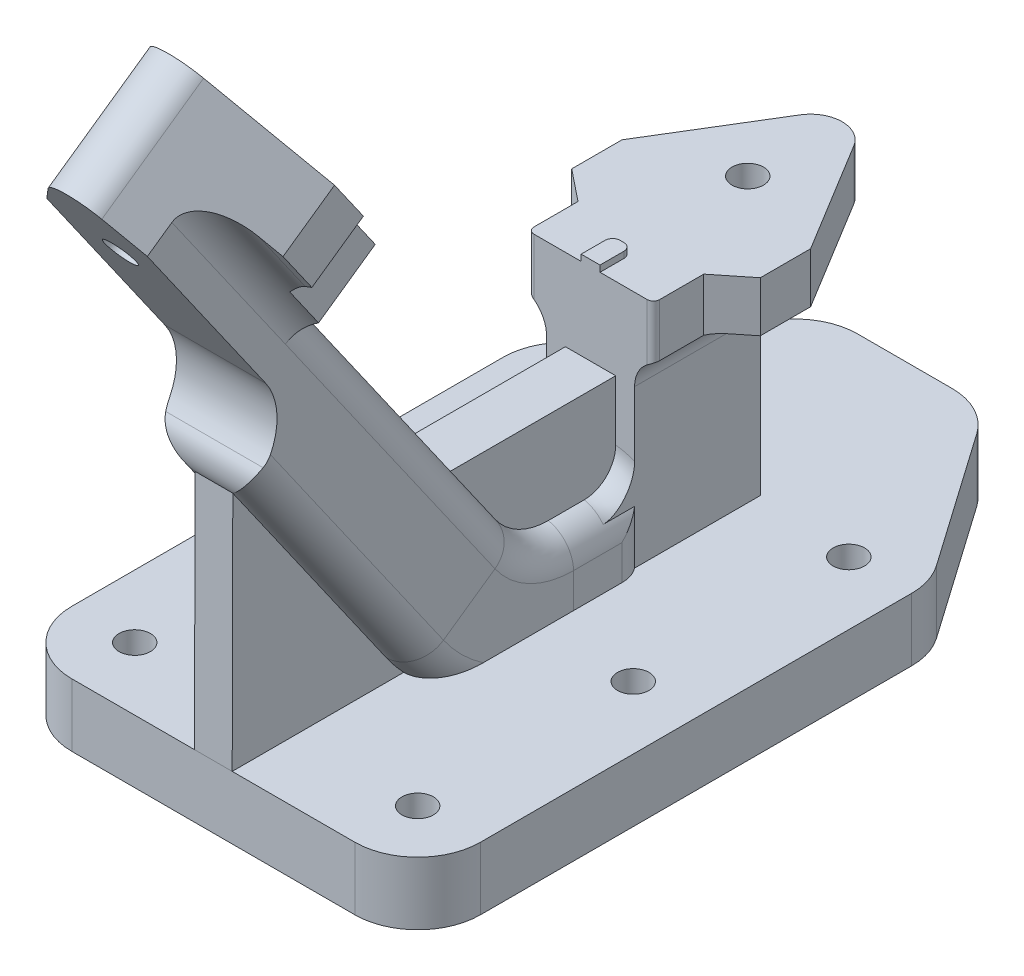
from build123d import *

# Parameters (mm, degrees)
BOSS_EXTRUDE1_DEPTH = 4
SKETCH2_R           = 2.5
CUT_EXTRUDE1_DEPTH  = 12
BOSS_EXTRUDE2_DEPTH = 40
SKETCH8_W           = 16
SKETCH8_H           = 20
BOSS_EXTRUDE4_DEPTH = 10
CUT_EXTRUDE2_START  = -60
CUT_EXTRUDE2_DEPTH  = 60
SKETCH11_R          = 2.5
CUT_EXTRUDE3_DEPTH  = 60
CUT_EXTRUDE4_DEPTH  = 30
FILLET1_R           = 5
SKETCH4_R           = 2.5
BOSS_EXTRUDE3_DEPTH = 10
RIB2_REACH          = 126.18
SKETCH14_WALL_W     = 288.63523274
SKETCH14_WALL_H     = 6
BOSS_EXTRUDE5_DEPTH = 1
BOSS_EXTRUDE6_DEPTH = 1
FILLET2_R           = 5
FILLET3_R           = 5
RIB3_REACH          = 126.18
SKETCH17_WALL_W     = 276.553771966
SKETCH17_WALL_H     = 8
FILLET4_R           = 5


with BuildPart() as part:
    # Sketch1 → Boss-Extrude1 (new, symmetric)
    with BuildSketch(Plane(origin=(0, 0, 0), x_dir=(1, 0, 0), z_dir=(0, 1, 0))):
        with BuildLine():
            Line((-15, -4), (-10, -8))
            Line((-10, -8), (-10, -15))
            ThreePointArc((-10, -15), (-9.707106781, -15.707106781), (-9, -16))
            Line((-9, -16), (9, -16))
            ThreePointArc((9, -16), (9.707106781, -15.707106781), (10, -15))
            Line((10, -15), (10, -8))
            Line((10, -8), (15, -4))
            Line((15, -4), (15, 4))
            Line((15, 4), (4.269254688, 21.602588021))
            ThreePointArc((4.269254688, 21.602588021), (0, 24), (-4.269254688, 21.602588021))
            Line((-4.269254688, 21.602588021), (-15, 4))
            Line((-15, 4), (-15, -4))
        make_face()
    extrude(amount=BOSS_EXTRUDE1_DEPTH, both=True)

    # Sketch2 → Cut-Extrude1 (cut, symmetric)
    with BuildSketch(Plane(origin=(0, 4, 0), x_dir=(1, 0, 0), z_dir=(0, 1, 0))):
        with Locations(Location((0, 9, 0), (0, 0, 270))):
            Circle(SKETCH2_R)
    extrude(amount=CUT_EXTRUDE1_DEPTH, both=True, mode=Mode.SUBTRACT)

    # Sketch3 → Boss-Extrude2 (add)
    with BuildSketch(Plane.XZ.offset(4)):
        with BuildLine():
            Line((-7, 16), (7, 16))
            Line((7, 16), (7, -4))
            Line((7, -4), (5.590169944, -4))
            ThreePointArc((5.590169944, -4), (0, -1.5), (-5.590169944, -4))
            Line((-5.590169944, -4), (-7, -4))
            Line((-7, -4), (-7, 16))
        make_face()
    extrude(amount=BOSS_EXTRUDE2_DEPTH)

    # Sweep2: sweep along a path in Sketch7
    with BuildLine(Plane(origin=(0, 0, 0), x_dir=(0, 0, -1), z_dir=(1, 0, 0))) as sweep2_path:
        Line((-104.705010427, 63.264235636), (-43.100894938, -24.715559106))
        ThreePointArc((-43.100894938, -24.715559106), (-35.952826317, -30.984247042), (-26.717854052, -33.244030379))
        Line((-26.717854052, -33.244030379), (-16, -33.244030379))
    # Sketch8 → Sweep2 (sweep)
    with BuildSketch(Plane(origin=(0, 63.264235636, 104.705010427), x_dir=(1, 0, 0), z_dir=(0, 0.8191520442889891, 0.5735764363510499))):
        with Locations((0, -0.242925444)):
            Rectangle(SKETCH8_W, SKETCH8_H)
    sweep(path=sweep2_path.line)

    # Sketch9 → Boss-Extrude4 (add)
    with BuildSketch(Plane(origin=(0, -22.785538427, 32.541121288), x_dir=(-1, 0, 0), z_dir=(-1.207999395513893e-15, 0.57357643635105, -0.819152044288989))):
        with BuildLine():
            Line((-15, 82.596209614), (-15, 74.596209614))
            Line((-15, 74.596209614), (-10, 70.596209614))
            Line((-10, 70.596209614), (-10, 62.596209614))
            Line((-10, 62.596209614), (10, 62.596209614))
            Line((10, 62.596209614), (10, 70.596209614))
            Line((10, 70.596209614), (15, 74.596209614))
            Line((15, 74.596209614), (15, 82.596209614))
            Line((15, 82.596209614), (4.269254688, 100.198797635))
            ThreePointArc((4.269254688, 100.198797635), (0, 102.596209614), (-4.269254688, 100.198797635))
            Line((-4.269254688, 100.198797635), (-15, 82.596209614))
        make_face()
    extrude(amount=BOSS_EXTRUDE4_DEPTH)

    # Sketch10 → Cut-Extrude2 (cut)
    with BuildSketch(Plane(origin=(0, -17.049774064, 24.349600845), x_dir=(-1, 0, 0), z_dir=(-1.207999395513893e-15, 0.57357643635105, -0.819152044288989)).offset(CUT_EXTRUDE2_START)):
        with BuildLine():
            Line((-13.101392133, 85.710663561), (-13.101392133, 131.179887232))
            Line((-13.101392133, 131.179887232), (12.430457948, 131.179887232))
            Line((12.430457948, 131.179887232), (12.430457948, 86.811256084))
            Line((12.430457948, 86.811256084), (4.269254688, 100.198797635))
            ThreePointArc((4.269254688, 100.198797635), (0, 102.596209614), (-4.269254688, 100.198797635))
            Line((-4.269254688, 100.198797635), (-13.101392133, 85.710663561))
        make_face()
    extrude(amount=CUT_EXTRUDE2_DEPTH, mode=Mode.SUBTRACT)

    # Sketch11 → Cut-Extrude3 (cut)
    with BuildSketch(Plane(origin=(0, -17.049774064, 24.349600845), x_dir=(-1, 0, 0), z_dir=(-1.207999395513893e-15, 0.57357643635105, -0.819152044288989))):
        with Locations(Location((0, 87.596209614, 0), (0, 0, 90))):
            Circle(SKETCH11_R)
    extrude(amount=-CUT_EXTRUDE3_DEPTH, mode=Mode.SUBTRACT)

    # Sketch12 → Cut-Extrude4 (cut, symmetric)
    with BuildSketch(Plane(origin=(0, 0, 0), x_dir=(0, 0, -1), z_dir=(1, 0, 0))):
        with BuildLine():
            Line((-117.126001141, 43.234336681), (-99.38041715, 55.659928361))
            Line((-99.38041715, 55.659928361), (-75.673754093, 21.80330477))
            ThreePointArc((-75.673754093, 21.80330477), (-74.017197005, 14.33105863), (-78.129510172, 7.876019964))
            Line((-78.129510172, 7.876019964), (-85.661803086, 2.601851685))
            Line((-85.661803086, 2.601851685), (-117.126001141, 43.234336681))
        make_face()
    extrude(amount=CUT_EXTRUDE4_DEPTH, both=True, mode=Mode.SUBTRACT)

    # Fillet1
    # the kernel refuses this fillet: 5 mm, written as the material it takes off along each edge
    with BuildSketch(Plane(origin=(-8, -13.244030379, 26.717854052), x_dir=(0, -0.573576436351047, 0.8191520442889911), z_dir=(0, 0.8191520442889911, 0.573576436351047))) as fillet1_piece_1:
        with BuildLine():
            CenterArc((30.242925444 - FILLET1_R, FILLET1_R), FILLET1_R, 270, 90)
            Line((30.242925444 - FILLET1_R, 0), (30.242925444, 0))
            Line((30.242925444, 0), (30.242925444, FILLET1_R))
        make_face()
    revolve(axis=Axis((-8, -13.244030379, 26.717854052), (1, 0, 0)), revolution_arc=55, mode=Mode.SUBTRACT)
    with BuildSketch(Plane(origin=(-8, -23.486955823, 26.717854052), x_dir=(0, -1, 0), z_dir=(0, 0, -1)), Plane(origin=(-8, -43.486955823, 26.717854052), x_dir=(1, 0, 0), z_dir=(0, 0, -1))) as fillet1_piece_2:
        with BuildLine():
            CenterArc((FILLET1_R, -FILLET1_R), FILLET1_R, 90, 90)
            Line((0, -FILLET1_R), (0, 0))
            Line((0, 0), (FILLET1_R, 0))
        make_face()
    extrude(amount=10.717854052, mode=Mode.SUBTRACT)
    with BuildSketch(Plane(origin=(-8, -13.244030379, 26.717854052), x_dir=(0, -0.5735764363510462, 0.8191520442889918), z_dir=(0, 0.8191520442889918, 0.5735764363510462))) as fillet1_piece_3:
        with BuildLine():
            CenterArc((10.242925444 + FILLET1_R, FILLET1_R), FILLET1_R, 180, 90)
            Line((10.242925444 + FILLET1_R, 0), (10.242925444, 0))
            Line((10.242925444, 0), (10.242925444, FILLET1_R))
        make_face()
    revolve(axis=Axis((-8, -13.244030379, 26.717854052), (1, 0, 0)), revolution_arc=55, mode=Mode.SUBTRACT)
    with BuildSketch(Plane(origin=(8, -23.486955823, 26.717854052), x_dir=(0, -1, 0), z_dir=(0, 0, -1)), Plane(origin=(8, -43.486955823, 26.717854052), x_dir=(-1, 0, 0), z_dir=(0, 0, -1))) as fillet1_piece_4:
        with BuildLine():
            CenterArc((FILLET1_R, FILLET1_R), FILLET1_R, 180, 90)
            Line((0, FILLET1_R), (0, 0))
            Line((0, 0), (FILLET1_R, 0))
        make_face()
    extrude(amount=10.717854052, mode=Mode.SUBTRACT)
    with BuildSketch(Plane(origin=(8, -13.244030379, 26.717854052), x_dir=(0, -0.5735764363510462, 0.8191520442889918), z_dir=(0, 0.8191520442889918, 0.5735764363510462))) as fillet1_piece_5:
        with BuildLine():
            CenterArc((10.242925444 + FILLET1_R, -FILLET1_R), FILLET1_R, 90, 90)
            Line((10.242925444, -FILLET1_R), (10.242925444, 0))
            Line((10.242925444, 0), (10.242925444 + FILLET1_R, 0))
        make_face()
    revolve(axis=Axis((8, -13.244030379, 26.717854052), (1, 0, 0)), revolution_arc=55, mode=Mode.SUBTRACT)
    with BuildSketch(Plane(origin=(8, -13.244030379, 26.717854052), x_dir=(0, -0.573576436351047, 0.8191520442889911), z_dir=(0, 0.8191520442889911, 0.573576436351047))) as fillet1_piece_6:
        with BuildLine():
            CenterArc((30.242925444 - FILLET1_R, -FILLET1_R), FILLET1_R, 360, 90)
            Line((30.242925444, -FILLET1_R), (30.242925444, 0))
            Line((30.242925444, 0), (30.242925444 - FILLET1_R, 0))
        make_face()
    revolve(axis=Axis((8, -13.244030379, 26.717854052), (1, 0, 0)), revolution_arc=55, mode=Mode.SUBTRACT)
    with BuildSketch(Plane(origin=(-8, 17.976084207, 85.498208501), x_dir=(1, 0, 0), z_dir=(0, -0.8191520442889891, -0.57357643635105)), Plane(origin=(8, 17.976084207, 85.498208501), x_dir=(0, 0.573576436351047, -0.8191520442889912), z_dir=(0, -0.8191520442889911, -0.573576436351047))) as fillet1_piece_7:
        with BuildLine():
            CenterArc((FILLET1_R, -FILLET1_R), FILLET1_R, 90, 90)
            Line((0, -FILLET1_R), (0, 0))
            Line((0, 0), (FILLET1_R, 0))
        make_face()
    extrude(amount=59.289046917, mode=Mode.SUBTRACT)
    with BuildSketch(Plane(origin=(-8, 28.490274643, 68.444832127), x_dir=(1, 0, 0), z_dir=(0, -0.8191520442889911, -0.573576436351047)), Plane(origin=(8, 28.490274643, 68.444832127), x_dir=(0, -0.573576436351047, 0.8191520442889911), z_dir=(0, -0.8191520442889911, -0.573576436351047))) as fillet1_piece_8:
        with BuildLine():
            CenterArc((FILLET1_R, FILLET1_R), FILLET1_R, 180, 90)
            Line((0, FILLET1_R), (0, 0))
            Line((0, 0), (FILLET1_R, 0))
        make_face()
    extrude(amount=58.120352659, mode=Mode.SUBTRACT)
    with BuildSketch(Plane(origin=(-18.564223743, 7.736683653, 78.328503046), x_dir=(0, 0.689586654474866, -0.7242031800331741), z_dir=(1, 0, 0))) as fillet1_piece_9:
        with BuildLine():
            CenterArc((4.31211568, -4.925658341), FILLET1_R, 99.892551715, 71.510050395)
            Line((-0.631700176, -4.178206148), (-1.126081762, -4.103460929))
            Line((-1.126081762, -4.103460929), (-0.494381586, 0.074745219))
            Line((-0.494381586, 0.074745219), (0.074745219, 0.494381586))
            ThreePointArc((0.074745219, 0.494381586), (0.314940952, 0.458066554), (3.367209974, 0.492565834))
            Line((3.367209974, 0.492565834), (3.453110493, 0))
        make_face()
    extrude(amount=37.128447486, mode=Mode.SUBTRACT)

    # Sketch4 → Boss-Extrude3 (add)
    with BuildSketch(Plane.XZ.offset(44)):
        with BuildLine():
            Line((-30.691520443, -8.313544262), (-15.691520443, -29.735764364))
            ThreePointArc((-15.691520443, -29.735764364), (-12.117486132, -32.870108332), (-7.5, -34))
            Line((-7.5, -34), (7.5, -34))
            ThreePointArc((7.5, -34), (12.117486132, -32.870108332), (15.691520443, -29.735764364))
            Line((15.691520443, -29.735764364), (30.691520443, -8.313544262))
            ThreePointArc((30.691520443, -8.313544262), (32.037169507, -5.584837894), (32.5, -2.577779899))
            Line((32.5, -2.577779899), (32.5, 66))
            ThreePointArc((32.5, 66), (29.571067812, 73.071067812), (22.5, 76))
            Line((22.5, 76), (-22.5, 76))
            ThreePointArc((-22.5, 76), (-29.571067812, 73.071067812), (-32.5, 66))
            Line((-32.5, 66), (-32.5, -2.577779899))
            ThreePointArc((-32.5, -2.577779899), (-32.037169507, -5.584837894), (-30.691520443, -8.313544262))
        make_face()
        with Locations(Location((-22.5, -2.577779899, 0), (0, 0, 270))):
            Circle(SKETCH4_R, mode=Mode.SUBTRACT)
        with Locations(Location((22.5, -2.577779899, 0), (0, 0, 270))):
            Circle(SKETCH4_R, mode=Mode.SUBTRACT)
        with Locations(Location((-22.5, 66, 0), (0, 0, 270))):
            Circle(SKETCH4_R, mode=Mode.SUBTRACT)
        with Locations(Location((22.5, 66, 0), (0, 0, 270))):
            Circle(SKETCH4_R, mode=Mode.SUBTRACT)
        with Locations(Location((-22.5, 31.711110051, 0), (0, 0, 270))):
            Circle(SKETCH4_R, mode=Mode.SUBTRACT)
        with Locations(Location((22.5, 31.711110051, 0), (0, 0, 270))):
            Circle(SKETCH4_R, mode=Mode.SUBTRACT)
    extrude(amount=-BOSS_EXTRUDE3_DEPTH)

    # Sketch14 wall → Rib2 (add, up to next)
    with BuildSketch(Plane(origin=(0, -14.862399268, 75.952373561), x_dir=(0, 0.999996903371, -0.002488623923), z_dir=(0, 0.002488623923, 0.999996903371)), mode=Mode.PRIVATE) as rib2_sk1:
        Rectangle(SKETCH14_WALL_W, SKETCH14_WALL_H)
    rib2_tool1 = extrude(rib2_sk1.sketch, amount=-RIB2_REACH, mode=Mode.PRIVATE) - part.part
    add(rib2_tool1.solids().sort_by_distance((0, -14.862399268, 75.952373561))[0])

    # Sketch15 → Boss-Extrude5 (add, symmetric)
    with BuildSketch(Plane(origin=(0, 4, 0), x_dir=(1, 0, 0), z_dir=(0, 1, 0))):
        with BuildLine():
            Line((-0.3, -11), (0.3, -11))
            ThreePointArc((0.3, -11), (1.148528137, -11.351471863), (1.5, -12.2))
            Line((1.5, -12.2), (1.5, -16))
            Line((1.5, -16), (-1.5, -16))
            Line((-1.5, -16), (-1.5, -12.2))
            ThreePointArc((-1.5, -12.2), (-1.148528137, -11.351471863), (-0.3, -11))
        make_face()
    extrude(amount=BOSS_EXTRUDE5_DEPTH, both=True)

    # Sketch16 → Boss-Extrude6 (add, symmetric)
    with BuildSketch(Plane(origin=(0, -17.049774064, 24.349600845), x_dir=(-1, 0, 0), z_dir=(-1.207999395513893e-15, 0.57357643635105, -0.819152044288989))):
        with BuildLine():
            Line((-0.3, 67.596209614), (0.3, 67.596209614))
            ThreePointArc((0.3, 67.596209614), (1.148528137, 67.244737751), (1.5, 66.396209614))
            Line((1.5, 66.396209614), (1.5, 62.596209614))
            Line((1.5, 62.596209614), (-1.5, 62.596209614))
            Line((-1.5, 62.596209614), (-1.5, 66.396209614))
            ThreePointArc((-1.5, 66.396209614), (-1.148528137, 67.244737751), (-0.3, 67.596209614))
        make_face()
    extrude(amount=BOSS_EXTRUDE6_DEPTH, both=True)

    # Fillet2
    fillet2_edges = [part.edges().sort_by_distance(p)[0] for p in [
        (5.236067977, -24.014819868, 16),
        (-5.236067977, -24.014819868, 16),
        (0, -23.486955823, 16),
        (8, 41.384840811, 77.47370456),
        (-8, 41.384840811, 77.47370456),
    ]]
    fillet(fillet2_edges, radius=FILLET2_R)

    # Fillet3
    fillet3_edges = [part.edges().sort_by_distance(p)[0] for p in [
        (7, -4, 6),
        (-7, -4, 6),
    ]]
    fillet(fillet3_edges, radius=FILLET3_R)

    # Sketch17 wall → Rib3 (add, up to next)
    with BuildSketch(Plane(origin=(0, -9, 29.096929607), x_dir=(0, 0, 1), z_dir=(0, -1, 0)), mode=Mode.PRIVATE) as rib3_sk1:
        Rectangle(SKETCH17_WALL_W, SKETCH17_WALL_H)
    rib3_tool1 = extrude(rib3_sk1.sketch, amount=RIB3_REACH, mode=Mode.PRIVATE) - part.part
    add(rib3_tool1.solids().sort_by_distance((0, -9, 29.096929607))[0])

    # Fillet4
    # the kernel refuses this fillet: 5 mm, written as the material it takes off along each edge
    with BuildSketch(Plane(origin=(-8, -20.986955823, 16), x_dir=(1, 0, 0), z_dir=(0, -1, 0)), Plane(origin=(8, -34, 16), x_dir=(-1, 0, 0), z_dir=(0, 1, 0))) as fillet4_piece_1:
        with BuildLine():
            CenterArc((5, 3), FILLET4_R, 180, 36.869897646)
            Line((0, 3), (-0.1, 3))
            Line((-0.1, 3), (-0.1, 0))
            Line((-0.1, 0), (0, -0.1))
            ThreePointArc((0, -0.1), (0.5, -0.1), (0.92, -0.06))
            Line((0.92, -0.06), (1, 0))
        make_face()
    extrude(amount=13.013044177, mode=Mode.SUBTRACT)


solid = part.part
